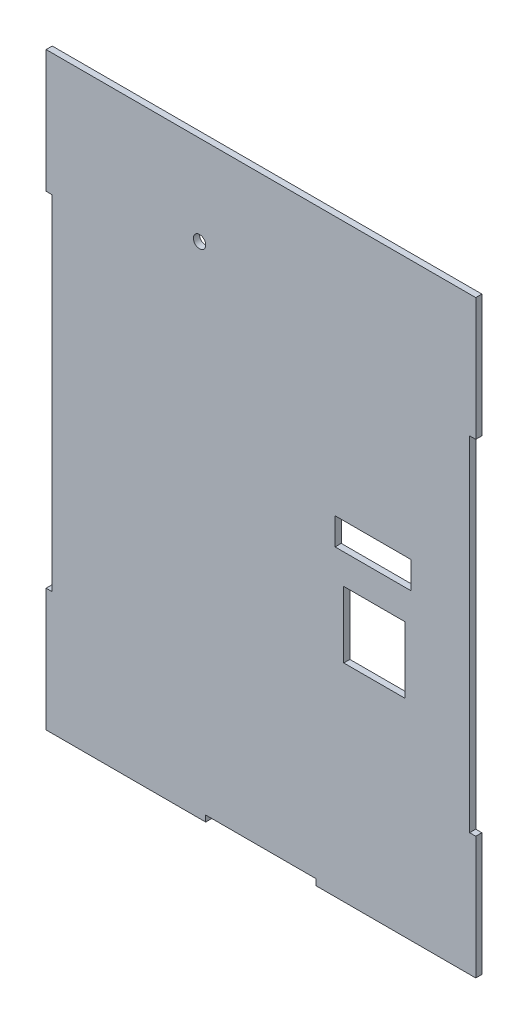
from build123d import *

# Parameters (mm, degrees)
SKETCH1_W                = 457.2
SKETCH1_H                = 609.6
BOSS_EXTRUDE2_DEPTH      = 6.35
CUT_EXTRUDE1_REACH       = 764.026
SKETCH2_W                = 63.5
SKETCH2_H                = 68.58
SKETCH3_W                = 73.66
SKETCH3_H                = 27.94
CUT_EXTRUDE2_DEPTH       = 63.5
CUT_EXTRUDE4_DEPTH       = 763.026457874
CUT_EXTRUDE4_DEPTH_BACK  = 763.026457874
SKETCH5_W                = 5.08
SKETCH5_H                = 27.94
CUT_EXTRUDE5_DEPTH       = 763.026457874
CUT_EXTRUDE5_DEPTH_BACK  = 763.026457874
CUT_EXTRUDE6_DEPTH       = 763.026457874
CUT_EXTRUDE6_DEPTH_BACK  = 763.026457874
SKETCH7_W                = 12.7
SKETCH7_H                = 355.6
CUT_EXTRUDE8_START       = -6.35
CUT_EXTRUDE8_OUTLINE_W   = 6.35
CUT_EXTRUDE8_OUTLINE_H   = 127
CUT_EXTRUDE8_DEPTH       = 6.35
CUT_EXTRUDE9_DEPTH       = 763.026457874
CUT_EXTRUDE9_DEPTH_BACK  = 763.026457874
CUT_EXTRUDE10_START      = -6.35
CUT_EXTRUDE10_OUTLINE_W  = 6.35
CUT_EXTRUDE10_OUTLINE_H  = 127
CUT_EXTRUDE10_DEPTH      = 6.35
CUT_EXTRUDE11_DEPTH      = 759.233608461
CUT_EXTRUDE11_DEPTH_BACK = 759.233608461
CUT_EXTRUDE12_DEPTH      = 759.233608461
CUT_EXTRUDE12_DEPTH_BACK = 759.233608461
SKETCH4_R                = 6.4135
CUT_EXTRUDE13_DEPTH      = 759.233608461


# Read off the part's stored shape, not the designer's step: Cut-Extrude8, Cut-Extrude10
with BuildPart() as part:
    # Sketch1 → Boss-Extrude2 (new body)
    with BuildSketch(Plane.XY):
        with Locations((-228.6, 304.8)):
            Rectangle(SKETCH1_W, SKETCH1_H)
    extrude(amount=BOSS_EXTRUDE2_DEPTH)

    # Sketch2 → Cut-Extrude1 (cut, up to next)
    with BuildSketch(Plane.XY.offset(6.35), mode=Mode.PRIVATE) as cut_extrude1_sk1:
        with Locations((-111.175624359, 248.287614127)):
            Rectangle(SKETCH2_W, SKETCH2_H)
    cut_extrude1_tool1 = extrude(cut_extrude1_sk1.sketch, amount=-CUT_EXTRUDE1_REACH, mode=Mode.PRIVATE) & part.part
    add(cut_extrude1_tool1.solids().sort_by_distance((-111.175624, 248.287614, 6.35))[0], mode=Mode.SUBTRACT)

    # Sketch3 → Cut-Extrude2 (cut)
    with BuildSketch(Plane.XY.offset(6.35)):
        with Locations((-115.023623847, 327.440976048)):
            Rectangle(SKETCH3_W, SKETCH3_H)
    extrude(amount=-CUT_EXTRUDE2_DEPTH, mode=Mode.SUBTRACT)

    # Sketch5 → Cut-Extrude4 (cut, two sides: drawn at the far end of the back side and taken through both)
    with BuildSketch(Plane.XY.offset(6.35).offset(-CUT_EXTRUDE4_DEPTH_BACK)):
        with Locations((-75.653623847, 327.440976048)):
            Rectangle(SKETCH5_W, SKETCH5_H)
    extrude(amount=CUT_EXTRUDE4_DEPTH + CUT_EXTRUDE4_DEPTH_BACK, mode=Mode.SUBTRACT)

    # Sketch6 → Cut-Extrude5 (cut, two sides: drawn at the far end of the back side and taken through both)
    with BuildSketch(Plane.XY.offset(6.35).offset(-CUT_EXTRUDE5_DEPTH_BACK)):
        Polygon((-1796.763236556, 127), (-457.2, 127), (-444.5, 127), (-444.5, 482.6), (-457.2, 482.6), (-1796.763236556, 482.6), (-4475.889709667, 482.6), (-4475.889709667, 127), align=None)
    extrude(amount=CUT_EXTRUDE5_DEPTH + CUT_EXTRUDE5_DEPTH_BACK, mode=Mode.SUBTRACT)

    # Sketch7 → Cut-Extrude6 (cut, two sides: drawn at the far end of the back side and taken through both)
    with BuildSketch(Plane.XY.offset(6.35).offset(-CUT_EXTRUDE6_DEPTH_BACK)):
        with Locations((-6.35, 304.8)):
            Rectangle(SKETCH7_W, SKETCH7_H)
    extrude(amount=CUT_EXTRUDE6_DEPTH + CUT_EXTRUDE6_DEPTH_BACK, mode=Mode.SUBTRACT)

    # Cut-Extrude8 outline → Cut-Extrude8 (cut)
    with BuildSketch(Plane.XY.offset(6.35).offset(CUT_EXTRUDE8_START)):
        with Locations((-454.025, 63.5)):
            Rectangle(CUT_EXTRUDE8_OUTLINE_W, CUT_EXTRUDE8_OUTLINE_H)
    extrude(amount=CUT_EXTRUDE8_DEPTH, mode=Mode.SUBTRACT)

    # Sketch13 → Cut-Extrude9 (cut, two sides: drawn at the far end of the back side and taken through both)
    with BuildSketch(Plane.XY.offset(6.35).offset(-CUT_EXTRUDE9_DEPTH_BACK)):
        Polygon((-450.85, 2136.014036469), (-450.85, 609.6), (-450.85, 482.6), (-450.85, -1043.814036469), (-3503.678072938, -1043.814036469), (-3503.678072938, 2136.014036469), align=None)
    extrude(amount=CUT_EXTRUDE9_DEPTH + CUT_EXTRUDE9_DEPTH_BACK, mode=Mode.SUBTRACT)

    # Cut-Extrude10 outline → Cut-Extrude10 (cut)
    with BuildSketch(Plane.XY.offset(6.35).offset(CUT_EXTRUDE10_START)):
        with Locations((-3.175, 546.1)):
            Rectangle(CUT_EXTRUDE10_OUTLINE_W, CUT_EXTRUDE10_OUTLINE_H)
    extrude(amount=CUT_EXTRUDE10_DEPTH, mode=Mode.SUBTRACT)

    # Sketch16 → Cut-Extrude11 (cut, two sides: drawn at the far end of the back side and taken through both)
    with BuildSketch(Plane.XY.offset(6.35).offset(-CUT_EXTRUDE11_DEPTH_BACK)):
        Polygon((-6.35, 1645.896828812), (-6.35, 127), (-6.35, 0), (-6.35, -1518.896828812), (3031.443657625, -1518.896828812), (3031.443657625, 1645.896828812), align=None)
    extrude(amount=CUT_EXTRUDE11_DEPTH + CUT_EXTRUDE11_DEPTH_BACK, mode=Mode.SUBTRACT)

    # Sketch9 → Cut-Extrude12 (cut, two sides: drawn at the far end of the back side and taken through both)
    with BuildSketch(Plane.XY.offset(6.35).offset(-CUT_EXTRUDE12_DEPTH_BACK)):
        Polygon((-171.45, -1351.158484296), (-171.45, 0), (-171.45, 6.35), (-285.75, 6.35), (-285.75, 0), (-285.75, -1351.158484296), (-285.75, -4053.475452889), (-171.45, -4053.475452889), align=None)
    extrude(amount=CUT_EXTRUDE12_DEPTH + CUT_EXTRUDE12_DEPTH_BACK, mode=Mode.SUBTRACT)

    # Sketch4 → Cut-Extrude13 (cut, through all)
    with BuildSketch(Plane.XY.offset(6.35)):
        with Locations((-292.1, 516.89)):
            Circle(SKETCH4_R)
    extrude(amount=-CUT_EXTRUDE13_DEPTH, mode=Mode.SUBTRACT)


solid = part.part
